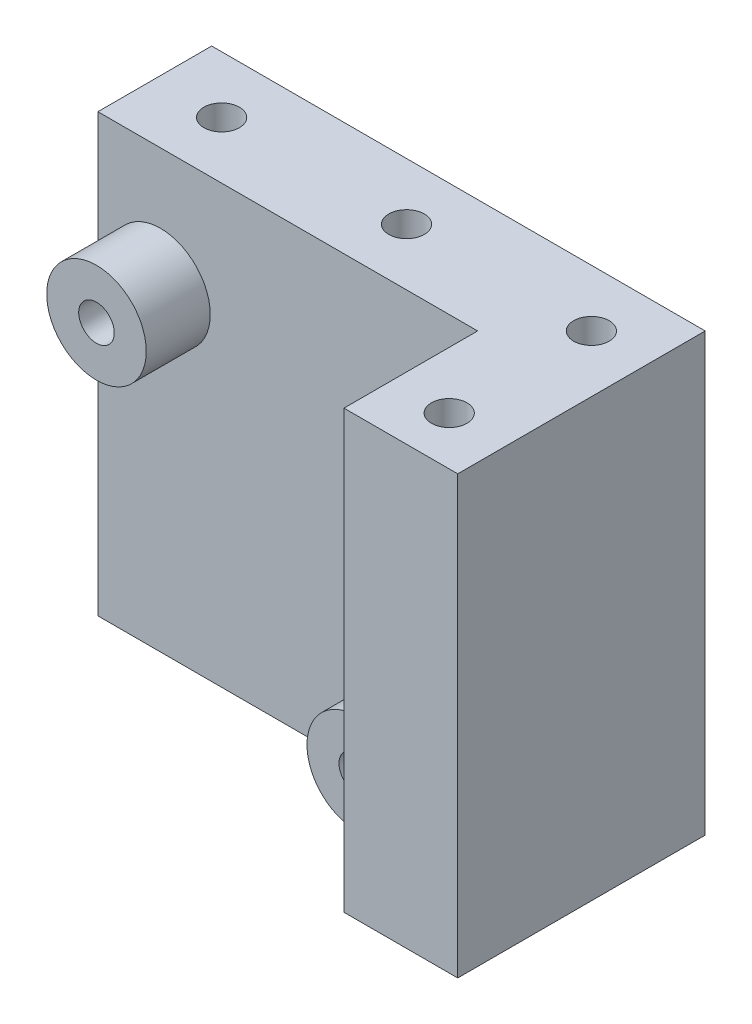
from build123d import *

# Parameters (mm, degrees)
ESQUISSE1_W             = 34.7
ESQUISSE1_H             = 30.7
BOSS_EXTRU_1_DEPTH      = 8
ESQUISSE2_R             = 3.5
ESQUISSE2_R_2           = 1.25
BOSS_EXTRU_2_DEPTH      = 4.5
ESQUISSE3_W             = 8
ESQUISSE3_H             = 30.7
BOSS_EXTRU_3_DEPTH      = 9.4
ESQUISSE4_R             = 1.25
ENL_V_MAT_EXTRU_1_DEPTH = 50.490807227
ESQUISSE6_R             = 1.25
ENL_V_MAT_EXTRU_2_DEPTH = 40.090567916


with BuildPart() as part:
    # Esquisse1 → Boss.-Extru.1 (new body)
    with BuildSketch(Plane.XY):
        with Locations((-17.35, 0)):
            Rectangle(ESQUISSE1_W, ESQUISSE1_H)
    extrude(amount=BOSS_EXTRU_1_DEPTH)

    # Esquisse2 → Boss.-Extru.2 (add, symmetric)
    # profile 1 of 2: a face of its own
    with BuildSketch(Plane.XY.offset(8)):
        with Locations((-30.3, 6.95)):
            Circle(ESQUISSE2_R)
        with Locations((-30.3, 6.95)):
            Circle(ESQUISSE2_R_2, mode=Mode.SUBTRACT)
    # profile 2 of 2: a face of its own
    with BuildSketch(Plane.XY.offset(8)):
        with Locations((-12, -11.35)):
            Circle(ESQUISSE2_R)
        with Locations((-12, -11.35)):
            Circle(ESQUISSE2_R_2, mode=Mode.SUBTRACT)
    extrude(amount=BOSS_EXTRU_2_DEPTH, both=True)

    # Esquisse3 → Boss.-Extru.3 (add)
    with BuildSketch(Plane.XY.offset(8)):
        with Locations((-4, 0)):
            Rectangle(ESQUISSE3_W, ESQUISSE3_H)
    extrude(amount=BOSS_EXTRU_3_DEPTH)

    # Esquisse4 → Enlèv. mat.-Extru.1 (cut, through all)
    with BuildSketch(Plane(origin=(0, 15.35, 0), x_dir=(1, 0, 0), z_dir=(0, 1, 0))):
        with Locations((-4, -14)):
            Circle(ESQUISSE4_R)
        with Locations((-4, -4)):
            Circle(ESQUISSE4_R)
        with Locations((-17, -4)):
            Circle(ESQUISSE4_R)
        with Locations((-30, -4)):
            Circle(ESQUISSE4_R)
    extrude(amount=-ENL_V_MAT_EXTRU_1_DEPTH, mode=Mode.SUBTRACT)

    # Esquisse6 → Enlèv. mat.-Extru.2 (cut, through all)
    with BuildSketch(Plane.XY.offset(8)):
        with Locations((-30.3, 6.95)):
            Circle(ESQUISSE6_R)
        with Locations((-12, -11.35)):
            Circle(ESQUISSE6_R)
    extrude(amount=-ENL_V_MAT_EXTRU_2_DEPTH, mode=Mode.SUBTRACT)


solid = part.part
